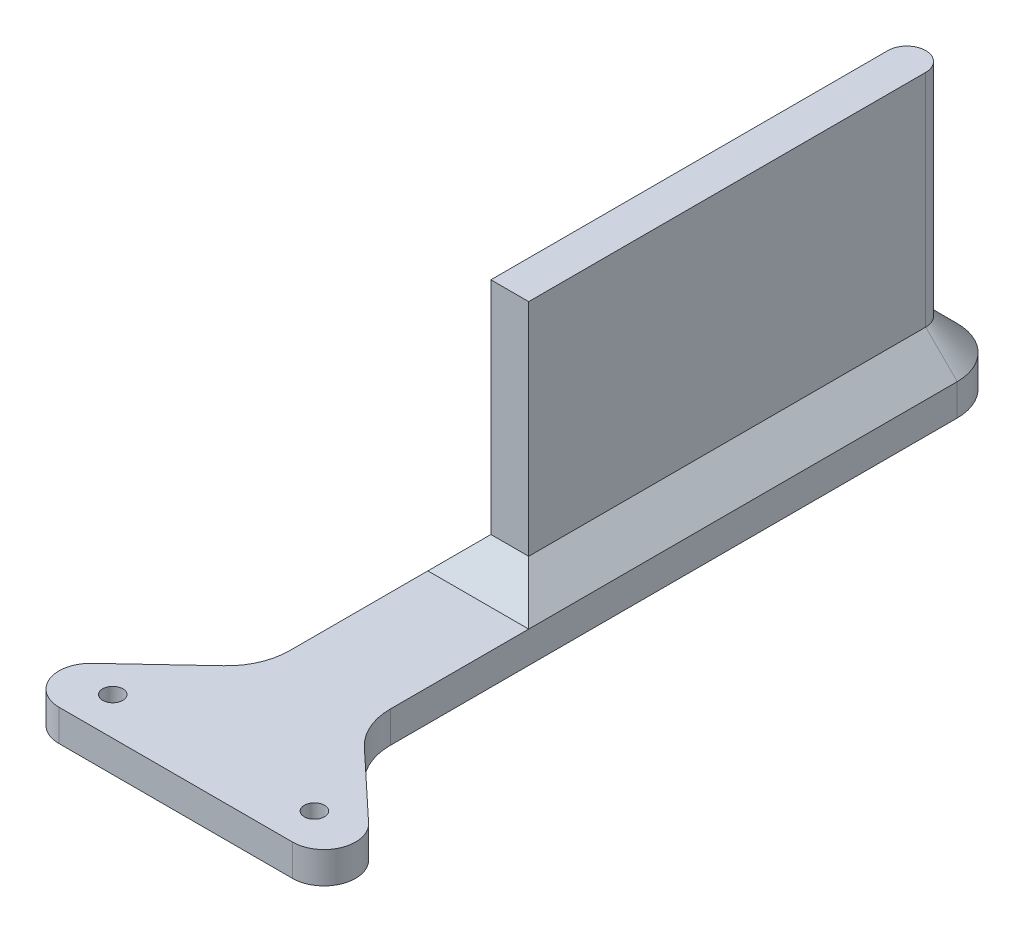
from build123d import *

# Parameters (mm, degrees)
SKETCH1_R           = 1
BOSS_EXTRUDE1_DEPTH = 3
BOSS_EXTRUDE2_DEPTH = 40
CHAMFER1_SIZE       = 5
SKETCH3_R           = 1.6
CUT_EXTRUDE1_DEPTH  = 10
BOSS_EXTRUDE3_START = -3
SKETCH4_R           = 1
BOSS_EXTRUDE3_DEPTH = 3
BOSS_EXTRUDE4_START = 2
SKETCH5_R           = 1.6
BOSS_EXTRUDE4_DEPTH = 2


with BuildPart() as part:
    # Sketch1 → Boss-Extrude1 (new body)
    with BuildSketch(Plane(origin=(0, 0, 0), x_dir=(1, 0, 0), z_dir=(0, 1, 0))):
        with BuildLine():
            Line((-18.528780813, -6), (18.528780813, -6))
            ThreePointArc((18.528780813, -6), (23.17842758, -2.838691096), (21.948486458, 2.647686021))
            Line((21.948486458, 2.647686021), (11.160588711, 12.761340158))
            ThreePointArc((11.160588711, 12.761340158), (8.824104597, 16.081420568), (8, 20.056712199))
            Line((8, 20.056712199), (8, 95))
            Line((8, 95), (8, 110))
            ThreePointArc((8, 110), (0, 118), (-8, 110))
            Line((-8, 110), (-8, 95))
            Line((-8, 95), (-8, 20.056712199))
            ThreePointArc((-8, 20.056712199), (-8.824104597, 16.081420568), (-11.160588711, 12.761340158))
            Line((-11.160588711, 12.761340158), (-21.948486458, 2.647686021))
            ThreePointArc((-21.948486458, 2.647686021), (-23.17842758, -2.838691096), (-18.528780813, -6))
        make_face()
        with Locations(Location((0, 15, 0), (0, 0, 270))):
            Circle(SKETCH1_R, mode=Mode.SUBTRACT)
        with Locations(Location((-16, 0, 0), (0, 0, 270))):
            Circle(SKETCH1_R, mode=Mode.SUBTRACT)
        with Locations(Location((16, 0, 0), (0, 0, 270))):
            Circle(SKETCH1_R, mode=Mode.SUBTRACT)
    extrude(amount=BOSS_EXTRUDE1_DEPTH)

    # Sketch2 → Boss-Extrude2 (add)
    with BuildSketch(Plane(origin=(0, 3, 0), x_dir=(1, 0, 0), z_dir=(0, 1, 0))):
        with BuildLine():
            Line((3, 47), (-3, 47))
            Line((-3, 47), (-3, 95))
            Line((-3, 95), (-3, 110))
            ThreePointArc((-3, 110), (0, 113), (3, 110))
            Line((3, 110), (3, 95))
            Line((3, 95), (3, 47))
        make_face()
    extrude(amount=BOSS_EXTRUDE2_DEPTH)

    # Chamfer1
    chamfer1_edges = [part.edges().sort_by_distance(p)[0] for p in [
        (3, 3, -78.5),
        (0, 3, -113),
        (-3, 3, -78.5),
        (0, 3, -47),
    ]]
    chamfer(chamfer1_edges, length=CHAMFER1_SIZE - 0.0001)  # a hair under: the kernel refuses the full size

    # Sketch3 → Cut-Extrude1 (cut)
    with BuildSketch(Plane(origin=(0, 3, 0), x_dir=(1, 0, 0), z_dir=(0, 1, 0))):
        with Locations(Location((-16, 0, 0), (0, 0, 270))):
            Circle(SKETCH3_R)
        with Locations(Location((16, 0, 0), (0, 0, 270))):
            Circle(SKETCH3_R)
    extrude(amount=-CUT_EXTRUDE1_DEPTH, mode=Mode.SUBTRACT)

    # Sketch4 → Boss-Extrude3 (add)
    with BuildSketch(Plane(origin=(0, 3, 0), x_dir=(1, 0, 0), z_dir=(0, 1, 0)).offset(BOSS_EXTRUDE3_START)):
        with Locations((0, 15)):
            Circle(SKETCH4_R)
    extrude(amount=BOSS_EXTRUDE3_DEPTH)

    # Sketch5 → Boss-Extrude4 (add)
    with BuildSketch(Plane.XZ.offset(BOSS_EXTRUDE4_START)):
        with BuildLine():
            Line((11.160588711, -12.761340158), (21.948486458, -2.647686021))
            ThreePointArc((21.948486458, -2.647686021), (23.17842758, 2.838691096), (18.528780813, 6))
            Line((18.528780813, 6), (-18.528780813, 6))
            ThreePointArc((-18.528780813, 6), (-23.17842758, 2.838691096), (-21.948486458, -2.647686021))
            Line((-21.948486458, -2.647686021), (-11.160588711, -12.761340158))
            ThreePointArc((-11.160588711, -12.761340158), (-8.824104597, -16.081420568), (-8, -20.056712199))
            Line((-8, -20.056712199), (-8, -110))
            ThreePointArc((-8, -110), (0, -118), (8, -110))
            Line((8, -110), (8, -20.056712199))
            ThreePointArc((8, -20.056712199), (8.824104597, -16.081420568), (11.160588711, -12.761340158))
        make_face()
        with Locations(Location((-16, 0, 0), (0, 0, 90))):
            Circle(SKETCH5_R, mode=Mode.SUBTRACT)
        with Locations(Location((16, 0, 0), (0, 0, 90))):
            Circle(SKETCH5_R, mode=Mode.SUBTRACT)
    extrude(amount=-BOSS_EXTRUDE4_DEPTH)


solid = part.part
